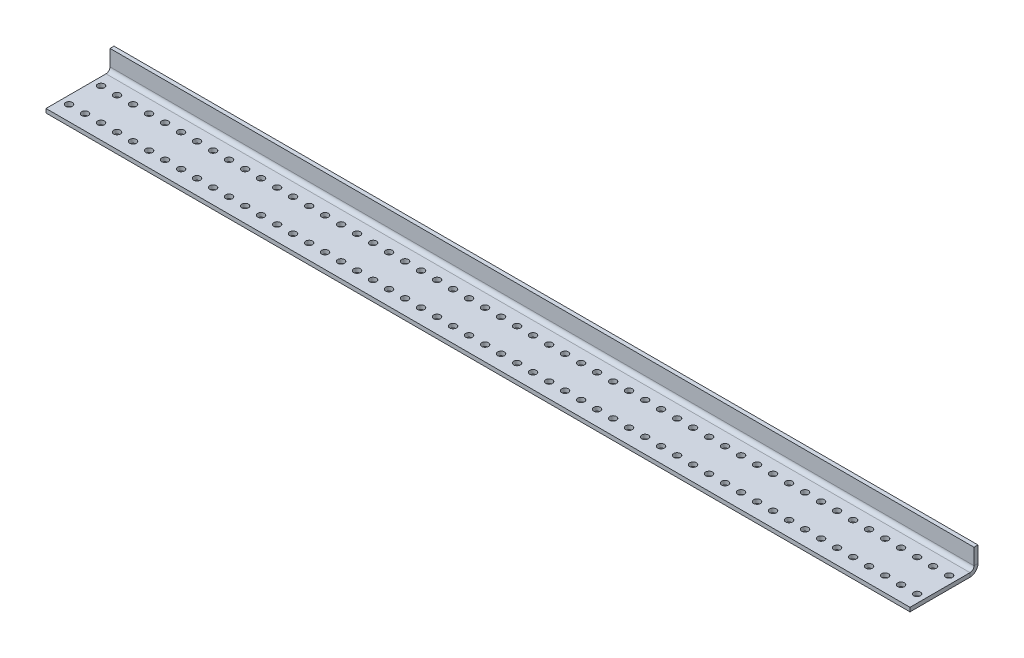
from build123d import *

# Parameters (mm, degrees)
BASE_FLANGE1_DEPTH     = 342.9
F_10_CLEARANCE_HOLE1_D = 5.334
LPATTERN1_COUNT        = 54
LPATTERN1_PITCH        = 12.7


# Sheet-metal steps are written as plain solids
with BuildPart() as part:
    # Sketch1 → Base-Flange1 (new, symmetric)
    with BuildSketch(Plane(origin=(0, 0, 0), x_dir=(0, 0, -1), z_dir=(1, 0, 0))):
        with BuildLine():
            Line((-53.975, 0), (-6.35, 0))
            ThreePointArc((-6.35, 0), (-1.859871939, 1.859871939), (0, 6.35))
            Line((0, 6.35), (0, 19.05))
            Line((0, 19.05), (-3.175, 19.05))
            Line((-3.175, 19.05), (-3.175, 6.35))
            ThreePointArc((-3.175, 6.35), (-4.10493597, 4.10493597), (-6.35, 3.175))
            Line((-6.35, 3.175), (-53.975, 3.175))
            Line((-53.975, 3.175), (-53.975, 0))
        make_face()
    extrude(amount=BASE_FLANGE1_DEPTH, both=True)

    # #10 Clearance Hole1 (through all)
    with Locations(Plane(origin=(0, 3.175, 0), x_dir=(1, 0, 0), z_dir=(0, 1, 0))):
        with Locations((-336.55, -42.037), (-336.55, -16.637)):
            f_10_clearance_hole1 = Hole(F_10_CLEARANCE_HOLE1_D / 2)

    # LPattern1: #10 Clearance Hole1 ×54
    with Locations(*[(i * LPATTERN1_PITCH, 0, 0) for i in range(1, LPATTERN1_COUNT)]):
        add(f_10_clearance_hole1, mode=Mode.SUBTRACT)


solid = part.part
